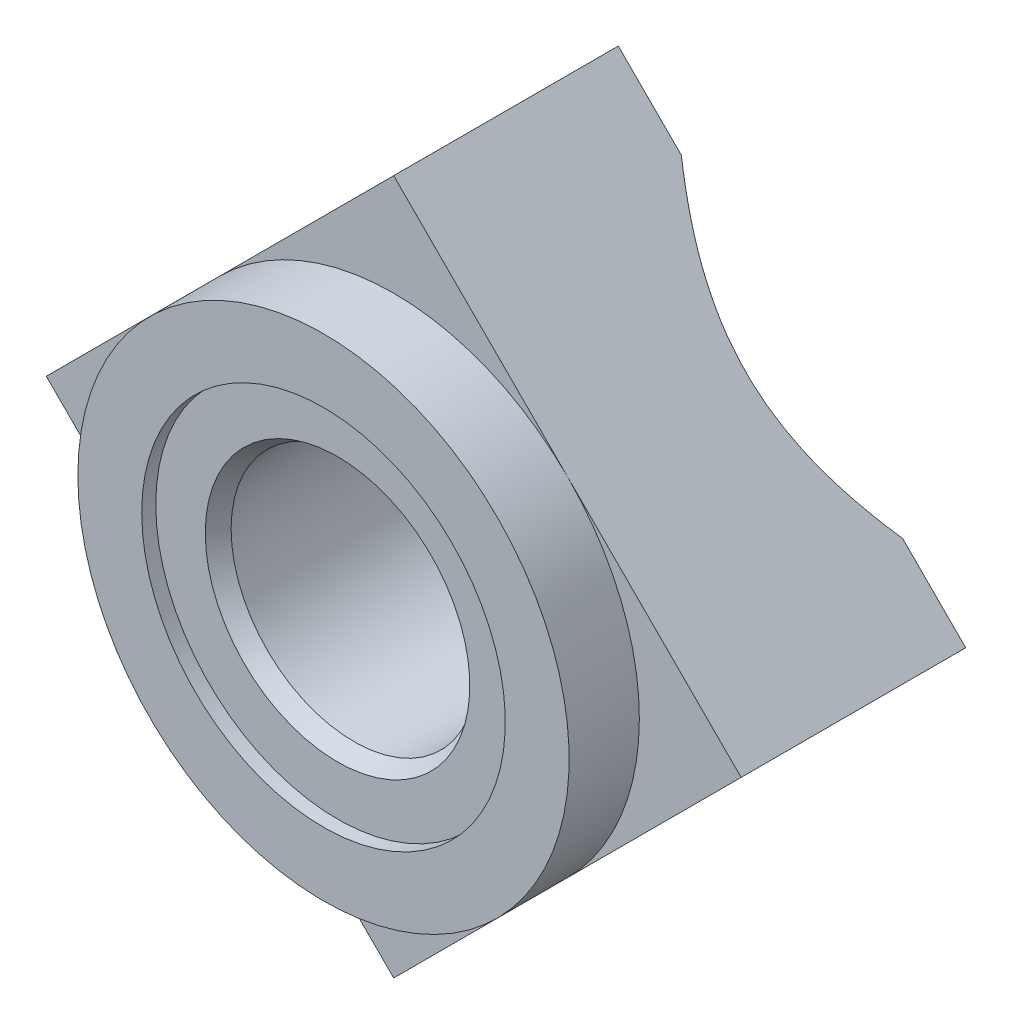
from build123d import *
from OCP.BRepFilletAPI import BRepFilletAPI_MakeChamfer

# Parameters (mm, degrees)
SKETCH1_W        = 7
SKETCH1_H        = 7
BASENUT_DEPTH    = 3.5
SKETCH4_R        = 1.75
HOLE_DEPTH       = 9.227945839
ENDCHAMFER_SIZE  = 0.233333333
ENDCHAMFER_SIZE2 = 0.134715063
EXTRUDE1_DEPTH   = 0.7


with BuildPart() as part:
    # Sketch1 → BaseNut (new body)
    with BuildSketch(Plane(origin=(0, 0, 0), x_dir=(0.7071067811865462, 0.7071067811865488, 0), z_dir=(0, 0, 1))):
        Rectangle(SKETCH1_W, SKETCH1_H)
    extrude(amount=-BASENUT_DEPTH)

    # Sketch3 → Bearing-Face (revolve, cut)
    with BuildSketch(Plane(origin=(0, 5.996043405, -1.046295936), x_dir=(0, 0, 1), z_dir=(-1, 0, 0))):
        Polygon((0.046295936, -9.496043405), (0.046295936, -10.945790873), (1.846295936, -10.945790873), (1.846295936, -5.996043405), (0.846295936, -5.996043405), (0.846295936, -8.586043405), (1.046295936, -8.586043405), (1.046295936, -9.496043405), align=None)
    revolve(axis=Axis((0, 0, -1.046295936), (0, 0, 1)), mode=Mode.SUBTRACT)

    # Sketch4 → Hole (cut, through all)
    with BuildSketch(Plane(origin=(0.057253883, -0.561970068, -3.5), x_dir=(-1, 0, 0), z_dir=(0, 0, -1))):
        with Locations((0.057253883, 0.561970068)):
            Circle(SKETCH4_R)
    extrude(amount=-HOLE_DEPTH, mode=Mode.SUBTRACT)

    # EndChamfer: one chamfer whose edges measure the first distance from different faces: ONE call of the kernel's chamfer builder (chamfer() names one face for all edges)
    endchamfer_edges_1 = [part.edges().sort_by_distance(p)[0] for p in [
        (1.75, 0, -3.5),
    ]]
    endchamfer_side_1 = [part.faces().sort_by_distance(p)[0] for p in [
        (-2.375878785, 2.375878785, -3.5),
    ]]
    endchamfer_edges_2 = [part.edges().sort_by_distance(p)[0] for p in [
        (1.75, 0, -0.2),
    ]]
    endchamfer_side_2 = [part.faces().sort_by_distance(p)[0] for p in [
        (1.75, 0, -1.85),
    ]]
    endchamfer = BRepFilletAPI_MakeChamfer(part.part.solid().wrapped)
    for e in endchamfer_edges_1:
        endchamfer.Add(ENDCHAMFER_SIZE, ENDCHAMFER_SIZE2, e.wrapped, endchamfer_side_1[0].wrapped)  # the first distance lies on this face
    for e in endchamfer_edges_2:
        endchamfer.Add(ENDCHAMFER_SIZE, ENDCHAMFER_SIZE2, e.wrapped, endchamfer_side_2[0].wrapped)  # the first distance lies on this face
    add(Compound.cast(endchamfer.Shape()), mode=Mode.REPLACE)

    # Sketch8 → Extrude1 (add)
    with BuildSketch(Plane(origin=(0, 0, -3.5), x_dir=(-1, 0, 0), z_dir=(0, 0, -1))):
        Polygon((-4.949747468, 0), (0, 4.949747468), (4.949747468, 0), (0, -4.949747468), align=None)
    extrude(amount=EXTRUDE1_DEPTH)

    # Sketch9 → Cut-Revolve1 (revolve, cut)
    with BuildSketch(Plane(origin=(2.504771604, 0, 1.644975864), x_dir=(0, 0, 1), z_dir=(0, 1, 0))):
        Polygon((-5.144975864, -2.504771604), (-5.144975864, -5.954519073), (-5.844975864, -6.654519073), (-5.844975864, -2.504771604), align=None)
    revolve(axis=Axis((0, 0, 5.820812651), (0, 0, -1)), mode=Mode.SUBTRACT)


solid = part.part
